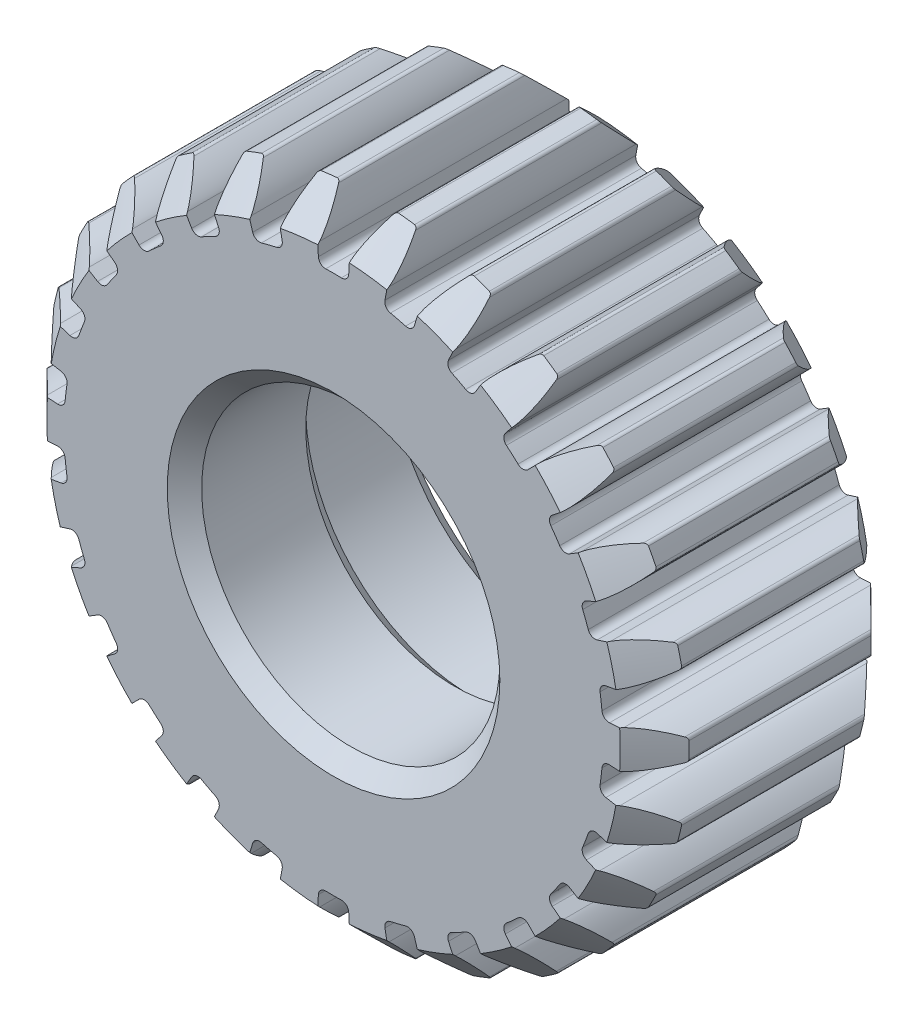
from build123d import *

# Parameters (mm, degrees)
SKETCH1_R                                 = 14.224
BOSS_EXTRUDE1_DEPTH                       = 11.1125
CUT_EXTRUDE_DCLTBC_DEPTH                  = 23.981122867
FILLET_TIP_DCLTBC_R                       = 0.158798261
FILLET_ROOT_DCLTBC_R                      = 0.317596521
CIRPATTERN_DCLTBC_COUNT                   = 26
FILLET_TIP_DCLTBC_OF_CIRPATTERN_DCLTBC_R  = 0.158798261
FILLET_ROOT_DCLTBC_OF_CIRPATTERN_DCLTBC_R = 0.317596521
SKETCH4_R                                 = 7.9375
CUT_EXTRUDE2_DEPTH                        = 23.941243664
SKETCH11_R                                = 7.9375
SKETCH11_R_2                              = 6.604
BOSS_EXTRUDE3_DEPTH                       = 6.1341
CHAMFER1_SIZE                             = 0.762


with BuildPart() as part:
    # Sketch1 → Boss-Extrude1 (new body)
    with BuildSketch(Plane.XY):
        Circle(SKETCH1_R)
    extrude(amount=BOSS_EXTRUDE1_DEPTH)

    # DCLTBC → Cut-Extrude-DCLTBC (cut, through all)
    with BuildSketch(Plane.XY):
        with BuildLine():
            Line((-0.701291918, 12.768049121), (-0.654714195, 11.920033277))
            ThreePointArc((-0.654714195, 11.920033277), (0, 11.938), (0.654714195, 11.920033277))
            Line((0.654714195, 11.920033277), (0.701291918, 12.768049121))
            add(Edge.make_bspline(
                [(0.701291918, 12.768049121), (0.701438055, 12.770288138), (0.701919445, 12.776563901), (0.703111941, 12.788412019), (0.705458923, 12.807720305), (0.70903905, 12.832283995), (0.714343616, 12.863986278), (0.721463561, 12.901268701), (0.73020086, 12.942170955), (0.740691816, 12.98659091), (0.752029246, 13.030831956), (0.764149894, 13.074891954), (0.776955412, 13.118714645), (0.793331549, 13.171713716), (0.814169762, 13.23514485), (0.840277589, 13.309101661), (0.871954349, 13.392754425), (0.906448964, 13.477758228), (0.942208094, 13.561189909), (0.980427141, 13.645231225), (1.018886177, 13.726364112), (1.060974399, 13.810362734), (1.100912409, 13.887758741), (1.148027672, 13.974155638), (1.186741813, 14.043787426), (1.228710553, 14.115446774), (1.249428806, 14.150283733), (1.260140073, 14.168070546)],
                knots=[0, 0, 0, 0, 0, 0.005376749, 0.015083688, 0.02853182, 0.04661014, 0.064854849, 0.092110526, 0.119476176, 0.146842496, 0.174208854, 0.201574956, 0.228941013, 0.256307345, 0.307035032, 0.361767352, 0.416499661, 0.471231937, 0.525964282, 0.580696616, 0.635428982, 0.690161387, 0.744893688, 0.799626082, 0.854358407, 0.909090914, 0.909090914, 0.909090914, 0.909090914, 0.909090914], degree=4))
            ThreePointArc((1.260140073, 14.168070546), (0, 14.224), (-1.260140073, 14.168070546))
            add(Edge.make_bspline(
                [(-0.701291918, 12.768049121), (-0.701438055, 12.770288138), (-0.701919445, 12.776563901), (-0.703111941, 12.788412019), (-0.705458923, 12.807720305), (-0.70903905, 12.832283995), (-0.714343616, 12.863986278), (-0.721463561, 12.901268701), (-0.73020086, 12.942170955), (-0.740691816, 12.98659091), (-0.752029246, 13.030831956), (-0.764149894, 13.074891954), (-0.776955412, 13.118714645), (-0.793331549, 13.171713716), (-0.814169762, 13.23514485), (-0.840277589, 13.309101661), (-0.871954349, 13.392754425), (-0.906448964, 13.477758228), (-0.942208094, 13.561189909), (-0.980427141, 13.645231225), (-1.018886177, 13.726364112), (-1.060974399, 13.810362734), (-1.100912409, 13.887758741), (-1.148027672, 13.974155638), (-1.186741813, 14.043787426), (-1.228710553, 14.115446774), (-1.249428806, 14.150283733), (-1.260140073, 14.168070546)],
                knots=[0, 0, 0, 0, 0, 0.005376749, 0.015083688, 0.02853182, 0.04661014, 0.064854849, 0.092110526, 0.119476176, 0.146842496, 0.174208854, 0.201574956, 0.228941013, 0.256307345, 0.307035032, 0.361767352, 0.416499661, 0.471231937, 0.525964282, 0.580696616, 0.635428982, 0.690161387, 0.744893688, 0.799626082, 0.854358407, 0.909090914, 0.909090914, 0.909090914, 0.909090914, 0.909090914], degree=4))
        make_face()
    cut_extrude_dcltbc = extrude(amount=CUT_EXTRUDE_DCLTBC_DEPTH, mode=Mode.SUBTRACT)

    # Fillet-Tip-DCLTBC
    fillet_tip_dcltbc_edges = [part.edges().sort_by_distance(p)[0] for p in [
        (1.260140073, 14.168070546, 5.55625),
        (-1.260140073, 14.168070546, 5.55625),
    ]]
    fillet(fillet_tip_dcltbc_edges, radius=FILLET_TIP_DCLTBC_R)

    # Fillet-Root-DCLTBC
    fillet_root_dcltbc_edges = [part.edges().sort_by_distance(p)[0] for p in [
        (0.654714195, 11.920033277, 5.55625),
        (-0.654714195, 11.920033277, 5.55625),
    ]]
    fillet(fillet_root_dcltbc_edges, radius=FILLET_ROOT_DCLTBC_R)

    # CirPattern-DCLTBC: Cut-Extrude-DCLTBC ×26 about axis
    cirpattern_dcltbc_axis = Axis((0, 0, 11.1125), (0, 0, 1))
    for i in range(1, CIRPATTERN_DCLTBC_COUNT):
        add(cut_extrude_dcltbc.rotate(cirpattern_dcltbc_axis, i * 360 / CIRPATTERN_DCLTBC_COUNT), mode=Mode.SUBTRACT)

    # Fillet-Tip-DCLTBC of CirPattern-DCLTBC
    fillet_tip_dcltbc_of_cirpattern_dcltbc_edges = [part.edges().sort_by_distance(p)[0] for p in [
        (-2.167118522, 14.057943424, 5.55625),
        (-4.614163907, 13.454800907, 5.55625),
        (-5.468432065, 13.130819729, 5.55625),
        (-7.700029306, 11.959587145, 5.55625),
        (-8.451940214, 11.440580519, 5.55625),
        (-10.338396991, 9.76932565, 5.55625),
        (-10.944252319, 9.085456355, 5.55625),
        (-12.375934621, 7.011306458, 5.55625),
        (-12.80052426, 6.202318492, 5.55625),
        (-13.694227916, 3.84581562, 5.55625),
        (-13.912876259, 2.958724422, 5.55625),
        (-14.216662461, 0.456819957, 5.55625),
        (-14.216662461, -0.456819957, 5.55625),
        (-13.912876259, -2.958724422, 5.55625),
        (-13.694227916, -3.84581562, 5.55625),
        (-12.80052426, -6.202318492, 5.55625),
        (-12.375934621, -7.011306458, 5.55625),
        (-10.944252319, -9.085456355, 5.55625),
        (-10.338396991, -9.76932565, 5.55625),
        (-8.451940214, -11.440580519, 5.55625),
        (-7.700029306, -11.959587145, 5.55625),
        (-5.468432065, -13.130819729, 5.55625),
        (-4.614163907, -13.454800907, 5.55625),
        (-2.167118522, -14.057943424, 5.55625),
        (-1.260140073, -14.168070546, 5.55625),
        (1.260140073, -14.168070546, 5.55625),
        (2.167118522, -14.057943424, 5.55625),
        (4.614163907, -13.454800907, 5.55625),
        (5.468432065, -13.130819729, 5.55625),
        (7.700029306, -11.959587145, 5.55625),
        (8.451940214, -11.440580519, 5.55625),
        (10.338396991, -9.76932565, 5.55625),
        (10.944252319, -9.085456355, 5.55625),
        (12.375934621, -7.011306458, 5.55625),
        (12.80052426, -6.202318492, 5.55625),
        (13.694227916, -3.84581562, 5.55625),
        (13.912876259, -2.958724422, 5.55625),
        (14.216662461, -0.456819957, 5.55625),
        (14.216662461, 0.456819957, 5.55625),
        (13.912876259, 2.958724422, 5.55625),
        (13.694227916, 3.84581562, 5.55625),
        (12.80052426, 6.202318492, 5.55625),
        (12.375934621, 7.011306458, 5.55625),
        (10.944252319, 9.085456355, 5.55625),
        (10.338396991, 9.76932565, 5.55625),
        (8.451940214, 11.440580519, 5.55625),
        (7.700029306, 11.959587145, 5.55625),
        (5.468432065, 13.130819729, 5.55625),
        (4.614163907, 13.454800907, 5.55625),
        (2.167118522, 14.057943424, 5.55625),
    ]]
    fillet(fillet_tip_dcltbc_of_cirpattern_dcltbc_edges, radius=FILLET_TIP_DCLTBC_OF_CIRPATTERN_DCLTBC_R)

    # Fillet-Root-DCLTBC of CirPattern-DCLTBC
    fillet_root_dcltbc_of_cirpattern_dcltbc_edges = [part.edges().sort_by_distance(p)[0] for p in [
        (-2.216961292, 11.730342136, 5.55625),
        (-3.488340072, 11.416975411, 5.55625),
        (-4.959795047, 10.858926148, 5.55625),
        (-6.119236304, 10.250404434, 5.55625),
        (-7.414383541, 9.356428844, 5.55625),
        (-8.394504765, 8.488117209, 5.55625),
        (-9.438075015, 7.310169903, 5.55625),
        (-10.181915121, 6.232531465, 5.55625),
        (-10.913259874, 4.83907046, 5.55625),
        (-11.37758958, 3.614733647, 5.55625),
        (-11.754205738, 2.086741831, 5.55625),
        (-11.912039889, 0.786860649, 5.55625),
        (-11.912039889, -0.786860649, 5.55625),
        (-11.754205738, -2.086741831, 5.55625),
        (-11.37758958, -3.614733647, 5.55625),
        (-10.913259874, -4.83907046, 5.55625),
        (-10.181915121, -6.232531465, 5.55625),
        (-9.438075015, -7.310169903, 5.55625),
        (-8.394504765, -8.488117209, 5.55625),
        (-7.414383541, -9.356428844, 5.55625),
        (-6.119236304, -10.250404434, 5.55625),
        (-4.959795047, -10.858926148, 5.55625),
        (-3.488340072, -11.416975411, 5.55625),
        (-2.216961292, -11.730342136, 5.55625),
        (-0.654714195, -11.920033277, 5.55625),
        (0.654714195, -11.920033277, 5.55625),
        (2.216961292, -11.730342136, 5.55625),
        (3.488340072, -11.416975411, 5.55625),
        (4.959795047, -10.858926148, 5.55625),
        (6.119236304, -10.250404434, 5.55625),
        (7.414383541, -9.356428844, 5.55625),
        (8.394504765, -8.488117209, 5.55625),
        (9.438075015, -7.310169903, 5.55625),
        (10.181915121, -6.232531465, 5.55625),
        (10.913259874, -4.83907046, 5.55625),
        (11.37758958, -3.614733647, 5.55625),
        (11.754205738, -2.086741831, 5.55625),
        (11.912039889, -0.786860649, 5.55625),
        (11.912039889, 0.786860649, 5.55625),
        (11.754205738, 2.086741831, 5.55625),
        (11.37758958, 3.614733647, 5.55625),
        (10.913259874, 4.83907046, 5.55625),
        (10.181915121, 6.232531465, 5.55625),
        (9.438075015, 7.310169903, 5.55625),
        (8.394504765, 8.488117209, 5.55625),
        (7.414383541, 9.356428844, 5.55625),
        (6.119236304, 10.250404434, 5.55625),
        (4.959795047, 10.858926148, 5.55625),
        (3.488340072, 11.416975411, 5.55625),
        (2.216961292, 11.730342136, 5.55625),
    ]]
    fillet(fillet_root_dcltbc_of_cirpattern_dcltbc_edges, radius=FILLET_ROOT_DCLTBC_OF_CIRPATTERN_DCLTBC_R)

    # Sketch4 → Cut-Extrude2 (cut, through all)
    # profile 1 of 2: a face of its own
    with BuildSketch(Plane.XY.offset(11.1125)):
        Circle(SKETCH4_R)
        with BuildLine():
            ThreePointArc((2.469162206, -2.0955), (0, 3.2385), (-2.469162206, -2.0955))
            Line((-2.469162206, -2.0955), (2.469162206, -2.0955))
        make_face(mode=Mode.SUBTRACT)
    # profile 2 of 2: a face of its own
    with BuildSketch(Plane.XY.offset(11.1125)):
        with BuildLine():
            Line((-2.469162206, -2.0955), (2.469162206, -2.0955))
            ThreePointArc((2.469162206, -2.0955), (0, 3.2385), (-2.469162206, -2.0955))
        make_face()
    extrude(amount=-CUT_EXTRUDE2_DEPTH, mode=Mode.SUBTRACT)

    # Sketch10 → Cut-Revolve1 (revolve, cut)
    with BuildSketch(Plane(origin=(0, 0, 0), x_dir=(1, 0, 0), z_dir=(0, 1, 0))):
        Polygon((14.224, 0), (14.224, -1.524), (12.7, 0), align=None)
        Polygon((12.7, -11.1125), (14.224, -11.1125), (14.224, -9.5885), align=None)
    revolve(axis=Axis((0, 0, 0), (0, 0, 1)), mode=Mode.SUBTRACT)

    # Sketch11 → Boss-Extrude3 (add)
    with BuildSketch(Plane.XY.offset(11.1125)):
        Circle(SKETCH11_R)
        Circle(SKETCH11_R_2, mode=Mode.SUBTRACT)
    extrude(amount=-BOSS_EXTRUDE3_DEPTH)

    # Chamfer1
    chamfer1_edges = [part.edges().sort_by_distance(p)[0] for p in [
        (-7.9375, 0, 0),
        (-6.604, 0, 11.1125),
        (-6.604, 0, 4.9784),
    ]]
    chamfer(chamfer1_edges, length=CHAMFER1_SIZE)


solid = part.part
